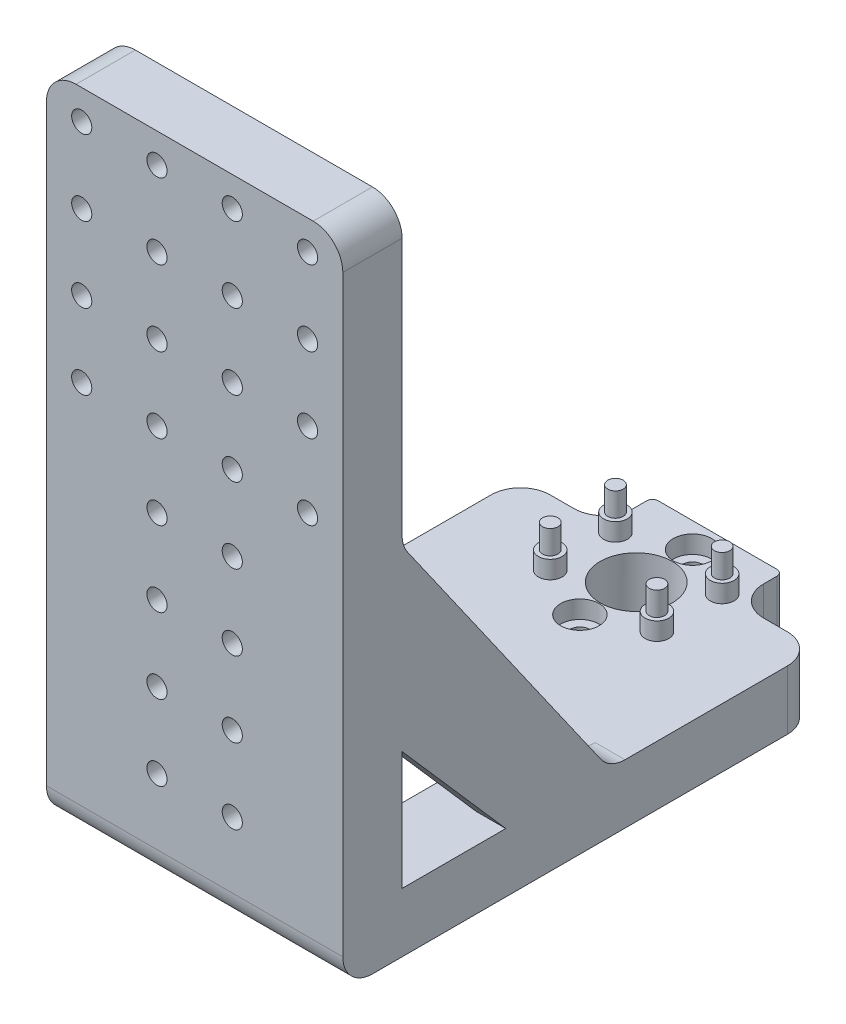
from build123d import *

# Parameters (mm, degrees)
SKETCH2_W                      = 22
SKETCH2_H                      = 27.5
BOSS_EXTRUDE1_DEPTH            = 10
SKETCH3_R                      = 1.3
BOSS_EXTRUDE2_DEPTH            = 7
SKETCH4_R                      = 6.075
CUT_EXTRUDE1_DEPTH             = 10
FILLET1_R                      = 1
CBORE_FOR_M3_SHCS1_D           = 3.4
CBORE_FOR_M3_SHCS1_DEPTH       = 10
CBORE_FOR_M3_SHCS1_CBORE_D     = 6.5
CBORE_FOR_M3_SHCS1_CBORE_DEPTH = 3
CBORE_FOR_M3_SHCS1_TIP         = 1.021463052
SKETCH8_R                      = 2
SKETCH8_R_2                    = 1.3
BOSS_EXTRUDE3_DEPTH            = 3
BOSS_EXTRUDE4_DEPTH            = 10
SKETCH10_W                     = 50
SKETCH10_H                     = 10
BOSS_EXTRUDE5_DEPTH            = 100
BOSS_EXTRUDE6_DEPTH            = 5
SKETCH12_W                     = 25
SKETCH12_H                     = 40
CUT_EXTRUDE2_DEPTH             = 10
FILLET2_START                  = -25
FILLET2_DEPTH                  = 5
FILLET2_START_2                = 20
FILLET2_2_DEPTH                = 5
FILLET2_3_DEPTH                = 10
FILLET2_4_DEPTH                = 50
FILLET2_START_3                = 24.5
FILLET2_5_DEPTH                = 50.5
FILLET2_START_4                = -1
FILLET2_6_DEPTH                = 11
CBORE_FOR_M3_SHCS2_AT_2_COUNT  = 2
CBORE_FOR_M3_SHCS2_AT_2_PITCH  = 12.7
CBORE_FOR_M3_SHCS2_AT_3_COUNT  = 2
CBORE_FOR_M3_SHCS2_AT_3_PITCH  = 25.4
CBORE_FOR_M3_SHCS2_AT_4_COUNT  = 2
CBORE_FOR_M3_SHCS2_AT_4_PITCH  = 38.1
LPATTERN1_COUNT                = 4
LPATTERN1_PITCH                = 12.7
CBORE_FOR_M3_SHCS3_AT_2_COUNT  = 2
CBORE_FOR_M3_SHCS3_AT_2_PITCH  = 12.7
LPATTERN2_COUNT                = 4
LPATTERN2_PITCH                = 12.7


with BuildPart() as part:
    # Sketch2 → Boss-Extrude1 (new body)
    with BuildSketch(Plane(origin=(0, 0, 0), x_dir=(1, 0, 0), z_dir=(0, 1, 0))):
        Rectangle(SKETCH2_W, SKETCH2_H)
    extrude(amount=BOSS_EXTRUDE1_DEPTH)

    # Sketch3 → Boss-Extrude2 (add)
    with BuildSketch(Plane(origin=(0, 10, 0), x_dir=(1, 0, 0), z_dir=(0, 1, 0))):
        with Locations(Location((-9, 5.5, 0), (0, 0, 90))):
            Circle(SKETCH3_R)
        with Locations(Location((9, 5.5, 0), (0, 0, 90))):
            Circle(SKETCH3_R)
        with Locations(Location((9, -5.5, 0), (0, 0, 90))):
            Circle(SKETCH3_R)
        with Locations(Location((-9, -5.5, 0), (0, 0, 90))):
            Circle(SKETCH3_R)
    extrude(amount=BOSS_EXTRUDE2_DEPTH)

    # Sketch4 → Cut-Extrude1 (cut)
    with BuildSketch(Plane(origin=(0, 10, 0), x_dir=(1, 0, 0), z_dir=(0, 1, 0))):
        with Locations(Location((0, 0, 0), (0, 0, 270))):
            Circle(SKETCH4_R)
    extrude(amount=-CUT_EXTRUDE1_DEPTH, mode=Mode.SUBTRACT)

    # Fillet1
    fillet1_edges = [part.edges().sort_by_distance(p)[0] for p in [
        (11, 5, 13.75),
        (-11, 5, 13.75),
        (-11, 5, -13.75),
        (11, 5, -13.75),
    ]]
    fillet(fillet1_edges, radius=FILLET1_R)

    # CBORE for M3 SHCS1
    with Locations(Plane(origin=(0, 10, 0), x_dir=(1, 0, 0), z_dir=(0, 1, 0))):
        with Locations((0, 9.5), (0, -9.5)):
            CounterBoreHole(CBORE_FOR_M3_SHCS1_D / 2, CBORE_FOR_M3_SHCS1_CBORE_D / 2, CBORE_FOR_M3_SHCS1_CBORE_DEPTH, depth=CBORE_FOR_M3_SHCS1_DEPTH)
            with Locations((0, 0, -(CBORE_FOR_M3_SHCS1_DEPTH + CBORE_FOR_M3_SHCS1_TIP / 2))):  # 118° drill point
                Cone(0, CBORE_FOR_M3_SHCS1_D / 2, CBORE_FOR_M3_SHCS1_TIP, mode=Mode.SUBTRACT)

    # Sketch8 → Boss-Extrude3 (add)
    # profile 1 of 4: a face of its own
    with BuildSketch(Plane(origin=(0, 10, 0), x_dir=(1, 0, 0), z_dir=(0, 1, 0))):
        with Locations(Location((-9, 5.5, 0), (0, 0, 180))):
            Circle(SKETCH8_R)
        with Locations(Location((-9, 5.5, 0), (0, 0, 270))):
            Circle(SKETCH8_R_2, mode=Mode.SUBTRACT)
    # profile 2 of 4: a face of its own
    with BuildSketch(Plane(origin=(0, 10, 0), x_dir=(1, 0, 0), z_dir=(0, 1, 0))):
        with Locations((9, 5.5)):
            Circle(SKETCH8_R)
        with Locations(Location((9, 5.5, 0), (0, 0, 270))):
            Circle(SKETCH8_R_2, mode=Mode.SUBTRACT)
    # profile 3 of 4: a face of its own
    with BuildSketch(Plane(origin=(0, 10, 0), x_dir=(1, 0, 0), z_dir=(0, 1, 0))):
        with Locations((9, -5.5)):
            Circle(SKETCH8_R)
        with Locations(Location((9, -5.5, 0), (0, 0, 270))):
            Circle(SKETCH8_R_2, mode=Mode.SUBTRACT)
    # profile 4 of 4: a face of its own
    with BuildSketch(Plane(origin=(0, 10, 0), x_dir=(1, 0, 0), z_dir=(0, 1, 0))):
        with Locations(Location((-9, -5.5, 0), (0, 0, 180))):
            Circle(SKETCH8_R)
        with Locations(Location((-9, -5.5, 0), (0, 0, 270))):
            Circle(SKETCH8_R_2, mode=Mode.SUBTRACT)
    extrude(amount=BOSS_EXTRUDE3_DEPTH)

    # Sketch9 → Boss-Extrude4 (add)
    with BuildSketch(Plane(origin=(0, 10, 0), x_dir=(1, 0, 0), z_dir=(0, 1, 0))):
        with BuildLine():
            Line((11, -5.5), (11, 5.5))
            Line((11, 5.5), (25, 5.5))
            Line((25, 5.5), (25, -74.5))
            Line((25, -74.5), (-25, -74.5))
            Line((-25, -74.5), (-25, 5.5))
            Line((-25, 5.5), (-11, 5.5))
            Line((-11, 5.5), (-11, -5.5))
            Line((-11, -5.5), (-11, -12.75))
            ThreePointArc((-11, -12.75), (-10.707106781, -13.457106781), (-10, -13.75))
            Line((-10, -13.75), (10, -13.75))
            ThreePointArc((10, -13.75), (10.707106781, -13.457106781), (11, -12.75))
            Line((11, -12.75), (11, -5.5))
        make_face()
    extrude(amount=-BOSS_EXTRUDE4_DEPTH)

    # Sketch10 → Boss-Extrude5 (add)
    with BuildSketch(Plane(origin=(0, 10, 0), x_dir=(1, 0, 0), z_dir=(0, 1, 0))):
        with Locations((0, -69.5)):
            Rectangle(SKETCH10_W, SKETCH10_H)
    extrude(amount=BOSS_EXTRUDE5_DEPTH)

    # Sketch11 → Boss-Extrude6 (add)
    with BuildSketch(Plane(origin=(25, 0, 0), x_dir=(0, 0, -1), z_dir=(1, 0, 0))):
        Polygon((-64.5, 60), (-29.5, 10), (-47, 10), (-64.5, 30), align=None)
    boss_extrude6 = extrude(amount=-BOSS_EXTRUDE6_DEPTH)

    # Mirror1: Boss-Extrude6 across plane
    add(boss_extrude6.mirror(Plane(origin=(0, 0, 0), x_dir=(0, 0, 1), z_dir=(1, 0, 0))))

    # Sketch12 → Cut-Extrude2 (cut)
    with BuildSketch(Plane(origin=(0, 10, 0), x_dir=(1, 0, 0), z_dir=(0, 1, 0))):
        with Locations((0, -44.5)):
            Rectangle(SKETCH12_W, SKETCH12_H)
    extrude(amount=-CUT_EXTRUDE2_DEPTH, mode=Mode.SUBTRACT)

    # Fillet2: read off the stored shape, not the designer's step
    # Fillet2 outline → Fillet2 (add)
    with BuildSketch(Plane.YZ.offset(FILLET2_START)):
        with BuildLine():
            ThreePointArc((58.708799432, 63.596159603), (60.07291423, 64.268689443), (61.576111154, 64.5))
            Line((61.576111154, 64.5), (60, 64.5))
            Line((60, 64.5), (58.708799432, 63.596159603))
        make_face()
        with BuildLine():
            ThreePointArc((10, 26.896722192), (10.565106619, 29.205774096), (12.132688278, 30.992881795))
            Line((12.132688278, 30.992881795), (10, 29.5))
            Line((10, 29.5), (10, 26.896722192))
        make_face()
    extrude(amount=FILLET2_DEPTH)

    # Fillet2 2 outline → Fillet2 2 (add)
    with BuildSketch(Plane.YZ.offset(FILLET2_START_2)):
        with BuildLine():
            ThreePointArc((58.708799432, 63.596159603), (60.07291423, 64.268689443), (61.576111154, 64.5))
            Line((61.576111154, 64.5), (60, 64.5))
            Line((60, 64.5), (58.708799432, 63.596159603))
        make_face()
        with BuildLine():
            ThreePointArc((10, 26.896722192), (10.565106619, 29.205774096), (12.132688278, 30.992881795))
            Line((12.132688278, 30.992881795), (10, 29.5))
            Line((10, 29.5), (10, 26.896722192))
        make_face()
    extrude(amount=FILLET2_2_DEPTH)

    # Fillet2 3 outline → Fillet2 3 (add)
    with BuildSketch(Plane(origin=(0, 0, 0), x_dir=(1, 0, 0), z_dir=(0, 1, 0))):
        with BuildLine():
            Line((11, 5.5), (16, 5.5))
            ThreePointArc((16, 5.5), (12.464466094, 6.964466094), (11, 10.5))
            Line((11, 10.5), (11, 5.5))
        make_face()
        with BuildLine():
            ThreePointArc((-11, 10.5), (-12.464466094, 6.964466094), (-16, 5.5))
            Line((-16, 5.5), (-11, 5.5))
            Line((-11, 5.5), (-11, 10.5))
        make_face()
        with BuildLine():
            Line((-12.5, -59.5), (-12.5, -64.5))
            Line((-12.5, -64.5), (-7.5, -64.5))
            ThreePointArc((-7.5, -64.5), (-11.035533906, -63.035533906), (-12.5, -59.5))
        make_face()
        with BuildLine():
            Line((-12.5, -24.5), (-12.5, -29.5))
            ThreePointArc((-12.5, -29.5), (-11.035533906, -25.964466094), (-7.5, -24.5))
            Line((-7.5, -24.5), (-12.5, -24.5))
        make_face()
        with BuildLine():
            ThreePointArc((12.5, -59.5), (11.035533906, -63.035533906), (7.5, -64.5))
            Line((7.5, -64.5), (12.5, -64.5))
            Line((12.5, -64.5), (12.5, -59.5))
        make_face()
        with BuildLine():
            Line((12.5, -24.5), (7.5, -24.5))
            ThreePointArc((7.5, -24.5), (11.035533906, -25.964466094), (12.5, -29.5))
            Line((12.5, -29.5), (12.5, -24.5))
        make_face()
    extrude(amount=FILLET2_3_DEPTH)

    # Fillet2 4 outline → Fillet2 4 (cut)
    with BuildSketch(Plane.YZ.offset(FILLET2_START)):
        with BuildLine():
            ThreePointArc((0, 69.5), (1.464466094, 73.035533906), (5, 74.5))
            Line((5, 74.5), (0, 74.5))
            Line((0, 74.5), (0, 69.5))
        make_face()
    extrude(amount=FILLET2_4_DEPTH, mode=Mode.SUBTRACT)

    # Fillet2 5 outline → Fillet2 5 (cut)
    with BuildSketch(Plane.XY.offset(FILLET2_START_3)):
        with BuildLine():
            Line((-25, 110), (-25, 105))
            ThreePointArc((-25, 105), (-23.535533906, 108.535533906), (-20, 110))
            Line((-20, 110), (-25, 110))
        make_face()
        with BuildLine():
            Line((25, 110), (20, 110))
            ThreePointArc((20, 110), (23.535533906, 108.535533906), (25, 105))
            Line((25, 105), (25, 110))
        make_face()
    extrude(amount=FILLET2_5_DEPTH, mode=Mode.SUBTRACT)

    # Fillet2 6 outline → Fillet2 6 (cut)
    with BuildSketch(Plane(origin=(0, 0, 0), x_dir=(1, 0, 0), z_dir=(0, 1, 0)).offset(FILLET2_START_4)):
        with BuildLine():
            ThreePointArc((20, 5.5), (23.535533906, 4.035533906), (25, 0.5))
            Line((25, 0.5), (25, 5.5))
            Line((25, 5.5), (20, 5.5))
        make_face()
        with BuildLine():
            ThreePointArc((-25, 0.5), (-23.535533906, 4.035533906), (-20, 5.5))
            Line((-20, 5.5), (-25, 5.5))
            Line((-25, 5.5), (-25, 0.5))
        make_face()
    extrude(amount=FILLET2_6_DEPTH, mode=Mode.SUBTRACT)

    # Sketch14 → CBORE for M3 SHCS2 (revolve, cut)
    with BuildSketch(Plane(origin=(19.05, 105, 64.5), x_dir=(0, 1, 0), z_dir=(1, 0, 0))):
        Polygon((0, 0), (0, 11.021463052), (1.7, 10), (1.7, 3), (3.25, 3), (3.25, 0), align=None)
    cbore_for_m3_shcs2 = revolve(axis=Axis((19.05, 105, 58.15), (0, 0, 1)), mode=Mode.SUBTRACT)

    # CBORE for M3 SHCS2 at 2: CBORE for M3 SHCS2 ×2
    with Locations(*[(-i * CBORE_FOR_M3_SHCS2_AT_2_PITCH, 0, 0) for i in range(1, CBORE_FOR_M3_SHCS2_AT_2_COUNT)]):
        add(cbore_for_m3_shcs2, mode=Mode.SUBTRACT)

    # CBORE for M3 SHCS2 at 3: CBORE for M3 SHCS2 ×2
    with Locations(*[(-i * CBORE_FOR_M3_SHCS2_AT_3_PITCH, 0, 0) for i in range(1, CBORE_FOR_M3_SHCS2_AT_3_COUNT)]):
        add(cbore_for_m3_shcs2, mode=Mode.SUBTRACT)

    # CBORE for M3 SHCS2 at 4: CBORE for M3 SHCS2 ×2
    with Locations(*[(-i * CBORE_FOR_M3_SHCS2_AT_4_PITCH, 0, 0) for i in range(1, CBORE_FOR_M3_SHCS2_AT_4_COUNT)]):
        add(cbore_for_m3_shcs2, mode=Mode.SUBTRACT)

    # LPattern1: CBORE for M3 SHCS2 ×4
    with Locations(*[(0, -i * LPATTERN1_PITCH, 0) for i in range(1, LPATTERN1_COUNT)]):
        add(cbore_for_m3_shcs2, mode=Mode.SUBTRACT)

    # LPattern1 copy 1 sketch → LPattern1 copy 1 (revolve, cut)
    with BuildSketch(Plane(origin=(6.35, 92.3, 64.5), x_dir=(0, 1, 0), z_dir=(1, 0, 0))):
        Polygon((0, 0), (0, 11.021463052), (1.7, 10), (1.7, 3), (3.25, 3), (3.25, 0), align=None)
    revolve(axis=Axis((6.35, 92.3, 58.15), (0, 0, 1)), mode=Mode.SUBTRACT)

    # LPattern1 copy 2 sketch → LPattern1 copy 2 (revolve, cut)
    with BuildSketch(Plane(origin=(6.35, 79.6, 64.5), x_dir=(0, 1, 0), z_dir=(1, 0, 0))):
        Polygon((0, 0), (0, 11.021463052), (1.7, 10), (1.7, 3), (3.25, 3), (3.25, 0), align=None)
    revolve(axis=Axis((6.35, 79.6, 58.15), (0, 0, 1)), mode=Mode.SUBTRACT)

    # LPattern1 copy 3 sketch → LPattern1 copy 3 (revolve, cut)
    with BuildSketch(Plane(origin=(6.35, 66.9, 64.5), x_dir=(0, 1, 0), z_dir=(1, 0, 0))):
        Polygon((0, 0), (0, 11.021463052), (1.7, 10), (1.7, 3), (3.25, 3), (3.25, 0), align=None)
    revolve(axis=Axis((6.35, 66.9, 58.15), (0, 0, 1)), mode=Mode.SUBTRACT)

    # LPattern1 copy 4 sketch → LPattern1 copy 4 (revolve, cut)
    with BuildSketch(Plane(origin=(-6.35, 92.3, 64.5), x_dir=(0, 1, 0), z_dir=(1, 0, 0))):
        Polygon((0, 0), (0, 11.021463052), (1.7, 10), (1.7, 3), (3.25, 3), (3.25, 0), align=None)
    revolve(axis=Axis((-6.35, 92.3, 58.15), (0, 0, 1)), mode=Mode.SUBTRACT)

    # LPattern1 copy 5 sketch → LPattern1 copy 5 (revolve, cut)
    with BuildSketch(Plane(origin=(-6.35, 79.6, 64.5), x_dir=(0, 1, 0), z_dir=(1, 0, 0))):
        Polygon((0, 0), (0, 11.021463052), (1.7, 10), (1.7, 3), (3.25, 3), (3.25, 0), align=None)
    revolve(axis=Axis((-6.35, 79.6, 58.15), (0, 0, 1)), mode=Mode.SUBTRACT)

    # LPattern1 copy 6 sketch → LPattern1 copy 6 (revolve, cut)
    with BuildSketch(Plane(origin=(-6.35, 66.9, 64.5), x_dir=(0, 1, 0), z_dir=(1, 0, 0))):
        Polygon((0, 0), (0, 11.021463052), (1.7, 10), (1.7, 3), (3.25, 3), (3.25, 0), align=None)
    revolve(axis=Axis((-6.35, 66.9, 58.15), (0, 0, 1)), mode=Mode.SUBTRACT)

    # LPattern1 copy 7 sketch → LPattern1 copy 7 (revolve, cut)
    with BuildSketch(Plane(origin=(-19.05, 92.3, 64.5), x_dir=(0, 1, 0), z_dir=(1, 0, 0))):
        Polygon((0, 0), (0, 11.021463052), (1.7, 10), (1.7, 3), (3.25, 3), (3.25, 0), align=None)
    revolve(axis=Axis((-19.05, 92.3, 58.15), (0, 0, 1)), mode=Mode.SUBTRACT)

    # LPattern1 copy 8 sketch → LPattern1 copy 8 (revolve, cut)
    with BuildSketch(Plane(origin=(-19.05, 79.6, 64.5), x_dir=(0, 1, 0), z_dir=(1, 0, 0))):
        Polygon((0, 0), (0, 11.021463052), (1.7, 10), (1.7, 3), (3.25, 3), (3.25, 0), align=None)
    revolve(axis=Axis((-19.05, 79.6, 58.15), (0, 0, 1)), mode=Mode.SUBTRACT)

    # LPattern1 copy 9 sketch → LPattern1 copy 9 (revolve, cut)
    with BuildSketch(Plane(origin=(-19.05, 66.9, 64.5), x_dir=(0, 1, 0), z_dir=(1, 0, 0))):
        Polygon((0, 0), (0, 11.021463052), (1.7, 10), (1.7, 3), (3.25, 3), (3.25, 0), align=None)
    revolve(axis=Axis((-19.05, 66.9, 58.15), (0, 0, 1)), mode=Mode.SUBTRACT)

    # Sketch17 → CBORE for M3 SHCS3 (revolve, cut)
    with BuildSketch(Plane(origin=(6.35, 54.2, 64.5), x_dir=(0, 1, 0), z_dir=(1, 0, 0))):
        Polygon((0, 0), (0, 11.021463052), (1.7, 10), (1.7, 3), (3.25, 3), (3.25, 0), align=None)
    cbore_for_m3_shcs3 = revolve(axis=Axis((6.35, 54.2, 58.15), (0, 0, 1)), mode=Mode.SUBTRACT)

    # CBORE for M3 SHCS3 at 2: CBORE for M3 SHCS3 ×2
    with Locations(*[(-i * CBORE_FOR_M3_SHCS3_AT_2_PITCH, 0, 0) for i in range(1, CBORE_FOR_M3_SHCS3_AT_2_COUNT)]):
        add(cbore_for_m3_shcs3, mode=Mode.SUBTRACT)

    # LPattern2: CBORE for M3 SHCS3 ×4
    with Locations(*[(0, -i * LPATTERN2_PITCH, 0) for i in range(1, LPATTERN2_COUNT)]):
        add(cbore_for_m3_shcs3, mode=Mode.SUBTRACT)

    # LPattern2 copy 1 sketch → LPattern2 copy 1 (revolve, cut)
    with BuildSketch(Plane(origin=(-6.35, 41.5, 64.5), x_dir=(0, 1, 0), z_dir=(1, 0, 0))):
        Polygon((0, 0), (0, 11.021463052), (1.7, 10), (1.7, 3), (3.25, 3), (3.25, 0), align=None)
    revolve(axis=Axis((-6.35, 41.5, 58.15), (0, 0, 1)), mode=Mode.SUBTRACT)

    # LPattern2 copy 2 sketch → LPattern2 copy 2 (revolve, cut)
    with BuildSketch(Plane(origin=(-6.35, 28.8, 64.5), x_dir=(0, 1, 0), z_dir=(1, 0, 0))):
        Polygon((0, 0), (0, 11.021463052), (1.7, 10), (1.7, 3), (3.25, 3), (3.25, 0), align=None)
    revolve(axis=Axis((-6.35, 28.8, 58.15), (0, 0, 1)), mode=Mode.SUBTRACT)

    # LPattern2 copy 3 sketch → LPattern2 copy 3 (revolve, cut)
    with BuildSketch(Plane(origin=(-6.35, 16.1, 64.5), x_dir=(0, 1, 0), z_dir=(1, 0, 0))):
        Polygon((0, 0), (0, 11.021463052), (1.7, 10), (1.7, 3), (3.25, 3), (3.25, 0), align=None)
    revolve(axis=Axis((-6.35, 16.1, 58.15), (0, 0, 1)), mode=Mode.SUBTRACT)


solid = part.part
